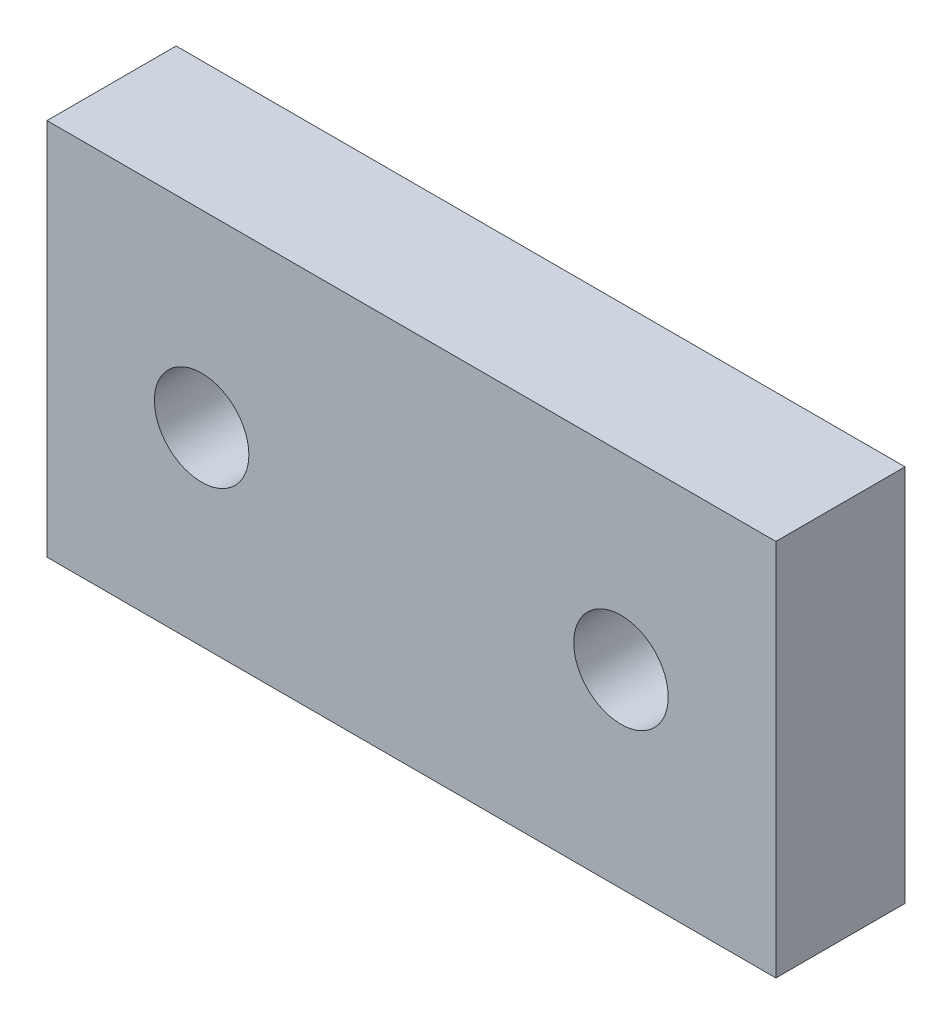
from build123d import *

# Parameters (mm, degrees)
SKETCH1_W          = 21.21128765
SKETCH1_H          = 11.00313828
BRACKETBASE_DEPTH  = 3.75882541
SKETCH2_R          = 1.375
CUT_EXTRUDE1_DEPTH = 25.189182381


with BuildPart() as part:
    # Sketch1 → bracketBase (new body)
    with BuildSketch(Plane.XY):
        with Locations((10.605643825, 5.50156914)):
            Rectangle(SKETCH1_W, SKETCH1_H)
    extrude(amount=BRACKETBASE_DEPTH)

    # Sketch2 → Cut-Extrude1 (cut, through all)
    with BuildSketch(Plane.XY.offset(3.75882541)):
        with Locations((4.50061561, 5.51479595)):
            Circle(SKETCH2_R)
        with Locations((16.70317329, 5.51479595)):
            Circle(SKETCH2_R)
    extrude(amount=-CUT_EXTRUDE1_DEPTH, mode=Mode.SUBTRACT)


solid = part.part
